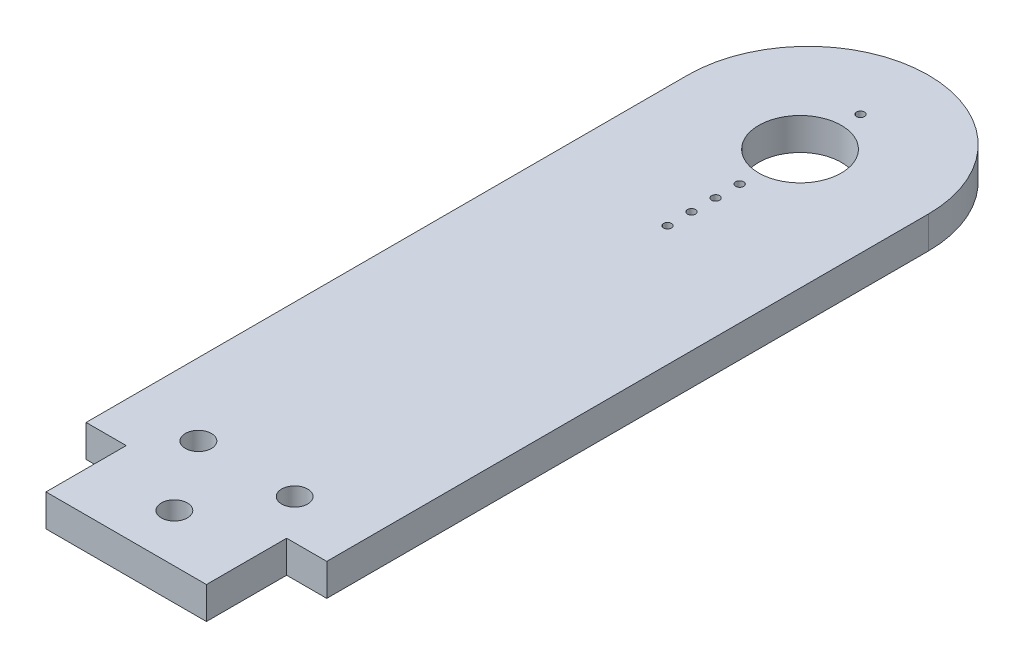
from build123d import *

# Parameters (mm, degrees)
SKETCH_1_R          = 1.625
SKETCH_1_R_2        = 5.15
EXTRUDE_1_DEPTH     = 4
FILLET_1_R          = 15
SKETCH_3_R          = 0.5
CUT_EXTRUDE_1_DEPTH = 102.197826064


with BuildPart() as part:
    # Эскиз1 → Бобышка-Вытянуть1 (new body)
    with BuildSketch(Plane(origin=(0, 0, 0), x_dir=(1, 0, 0), z_dir=(0, 1, 0))):
        Polygon((-10, 0), (10, 0), (10, 10), (15, 10), (15, 100), (-15, 100), (-15, 10), (-10, 10), align=None)
        with Locations(Location((-6, 15, 0), (0, 0, 270))):
            Circle(SKETCH_1_R, mode=Mode.SUBTRACT)
        with Locations(Location((0, 6, 0), (0, 0, 270))):
            Circle(SKETCH_1_R, mode=Mode.SUBTRACT)
        with Locations(Location((6, 15, 0), (0, 0, 90))):
            Circle(SKETCH_1_R, mode=Mode.SUBTRACT)
        with Locations(Location((0, 84, 0), (0, 0, 270))):
            Circle(SKETCH_1_R_2, mode=Mode.SUBTRACT)
    extrude(amount=EXTRUDE_1_DEPTH)

    # Скругление1
    fillet_1_edges = [part.edges().sort_by_distance(p)[0] for p in [
        (15, 2, -100),
        (-15, 2, -100),
    ]]
    fillet(fillet_1_edges, radius=FILLET_1_R - 0.0001)  # a hair under: the kernel refuses the full size

    # Эскиз3 → Вырез-Вытянуть1 (cut, through all)
    with BuildSketch(Plane(origin=(0, 4, 0), x_dir=(1, 0, 0), z_dir=(0, 1, 0))):
        with Locations(Location((0, 76.47, 0), (0, 0, 270))):
            Circle(SKETCH_3_R)
        with Locations(Location((0, 73.47, 0), (0, 0, 270))):
            Circle(SKETCH_3_R)
        with Locations(Location((0, 70.47, 0), (0, 0, 270))):
            Circle(SKETCH_3_R)
        with Locations(Location((0, 67.47, 0), (0, 0, 270))):
            Circle(SKETCH_3_R)
        with Locations(Location((0, 91.53, 0), (0, 0, 270))):
            Circle(SKETCH_3_R)
    extrude(amount=-CUT_EXTRUDE_1_DEPTH, mode=Mode.SUBTRACT)


solid = part.part
